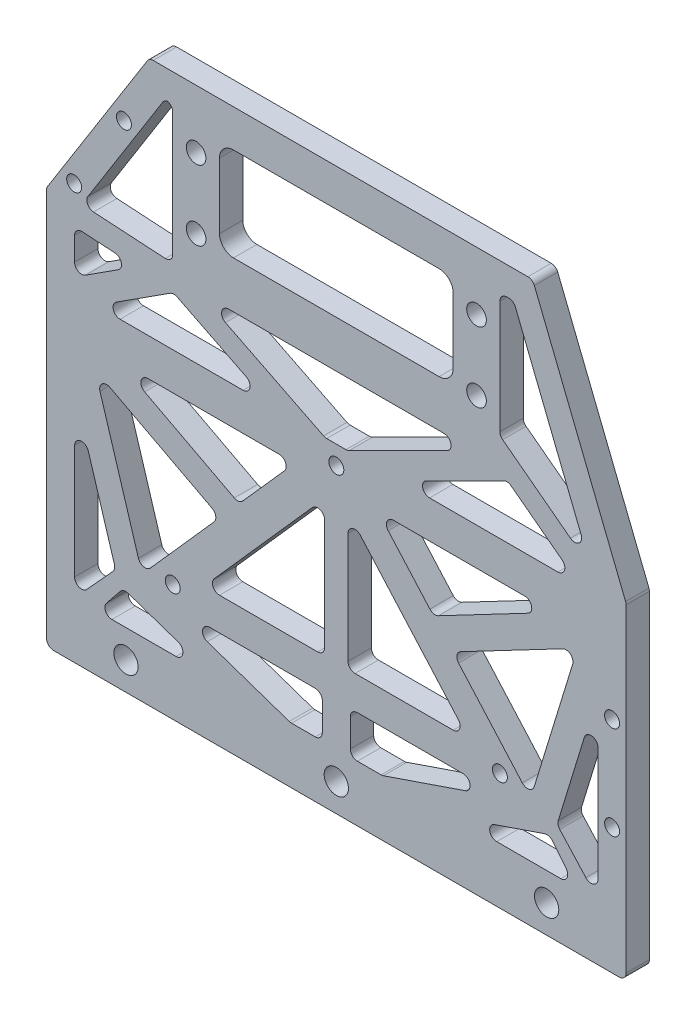
from build123d import *

# Parameters (mm, degrees)
SKETCH_1_W          = 124
SKETCH_1_H          = 120
EXTRUDE_1_DEPTH     = 5
SKETCH_2_R          = 1.6
CUT_EXTRUDE_1_DEPTH = 87.423376467
SKETCH_3_R          = 1.6
CUT_EXTRUDE_2_DEPTH = 87.423376467
SKETCH_4_R          = 2.1
CUT_EXTRUDE_3_DEPTH = 87.423376467
CHAMFER_1_SIZE      = 22
CHAMFER_1_SIZE2     = 35
CHAMFER_2_SIZE      = 50
CHAMFER_2_SIZE2     = 20
SKETCH_7_R          = 2.6
CUT_EXTRUDE_4_DEPTH = 87.423376467
SKETCH_8_R          = 1.6
CUT_EXTRUDE_5_DEPTH = 87.423376467
SKETCH_9_W          = 50
SKETCH_9_H          = 20
CUT_EXTRUDE_6_DEPTH = 10
FILLET_2_R          = 1.5
FILLET_3_R          = 3


with BuildPart() as part:
    # 草图1 → 凸台-拉伸1 (new body)
    with BuildSketch(Plane.XY):
        Rectangle(SKETCH_1_W, SKETCH_1_H)
    extrude(amount=EXTRUDE_1_DEPTH)

    # 草图2 → 切除-拉伸1 (cut, through all)
    with BuildSketch(Plane.XY.offset(5)):
        with Locations((-35, -35)):
            Circle(SKETCH_2_R)
        with Locations((35, -35)):
            Circle(SKETCH_2_R)
    extrude(amount=-CUT_EXTRUDE_1_DEPTH, mode=Mode.SUBTRACT)

    # 草图3 → 切除-拉伸2 (cut, through all)
    with BuildSketch(Plane.XY.offset(5)):
        with Locations((0, 4.5)):
            Circle(SKETCH_3_R)
    extrude(amount=-CUT_EXTRUDE_2_DEPTH, mode=Mode.SUBTRACT)

    # 草图4 → 切除-拉伸3 (cut, through all)
    with BuildSketch(Plane.XY.offset(5)):
        with Locations((-30, 47.5)):
            Circle(SKETCH_4_R)
        with Locations((30, 32.5)):
            Circle(SKETCH_4_R)
        with Locations((30, 47.5)):
            Circle(SKETCH_4_R)
        with Locations((-30, 32.5)):
            Circle(SKETCH_4_R)
    extrude(amount=-CUT_EXTRUDE_3_DEPTH, mode=Mode.SUBTRACT)

    # 倒角1
    chamfer_1_edges = [part.edges().sort_by_distance(p)[0] for p in [
        (-62, 60, 2.5),
    ]]
    chamfer_1_side = [part.faces().sort_by_distance(p)[0] for p in [
        (0, 60, 2.5),
    ]]
    chamfer(chamfer_1_edges, length=CHAMFER_1_SIZE, length2=CHAMFER_1_SIZE2, reference=chamfer_1_side[0])

    # 倒角2
    chamfer_2_edges = [part.edges().sort_by_distance(p)[0] for p in [
        (62, 60, 2.5),
    ]]
    chamfer_2_side = [part.faces().sort_by_distance(p)[0] for p in [
        (62, 0, 2.5),
    ]]
    chamfer(chamfer_2_edges, length=CHAMFER_2_SIZE, length2=CHAMFER_2_SIZE2, reference=chamfer_2_side[0])

    # 草图7 → 切除-拉伸4 (cut, through all)
    with BuildSketch(Plane.XY.offset(5)):
        with Locations((-45, -54)):
            Circle(SKETCH_7_R)
        with Locations((0, -54)):
            Circle(SKETCH_7_R)
        with Locations((45, -54)):
            Circle(SKETCH_7_R)
    extrude(amount=-CUT_EXTRUDE_4_DEPTH, mode=Mode.SUBTRACT)

    # 草图8 → 切除-拉伸5 (cut, through all)
    with BuildSketch(Plane(origin=(0, 0, 0), x_dir=(-1, 0, 0), z_dir=(0, 0, -1))):
        with Locations((-59, -33)):
            Circle(SKETCH_8_R)
        with Locations((-59, -13)):
            Circle(SKETCH_8_R)
        with Locations((45.442663531, 45.703937126)):
            Circle(SKETCH_8_R)
        with Locations((56.086094435, 28.771206142)):
            Circle(SKETCH_8_R)
    extrude(amount=-CUT_EXTRUDE_5_DEPTH, mode=Mode.SUBTRACT)

    # 草图9 → 切除-拉伸6 (cut)
    with BuildSketch(Plane.XY.offset(5)):
        Polygon((-20.795143669, -12.937322966), (-8.888654966, 0.5), (-46.405227211, 0.5), align=None)
        Polygon((46.405227211, 0.5), (8.888654966, 0.5), (20.795143669, -12.937322966), align=None)
        Polygon((36.651188431, 20.030509243), (13.590169944, 8.5), (51.861647432, 8.5), align=None)
        Polygon((-51.376856395, 8.5), (-13.590169944, 8.5), (-34.845181073, 19.127505564), align=None)
        Polygon((-2.409830056, 8.5), (2.409830056, 8.5), (29.409830056, 22), (-29.409830056, 22), align=None)
        with Locations((0, 42)):
            Rectangle(SKETCH_9_W, SKETCH_9_H)
        Polygon((56, -48), (56, -9.733809511), (47.224115046, -38.355523672), align=None)
        Polygon((-56, 20.766320607), (-56, 11.472020889), (-42.786156177, 19.966634775), align=None)
        Polygon((-47.224115046, -38.355523672), (-56, -9.733809511), (-56, -48), align=None)
        Polygon((-54.483388829, 25.683685076), (-35, 24.504573971), (-35, 54), (-36.684562306, 54), align=None)
        Polygon((-41.557478496, -36.369100842), (-24.893558667, -17.562677034), (-51.624213171, -3.53740308), align=None)
        Polygon((51.624213171, -3.53740308), (24.893558667, -17.562677034), (41.557478496, -36.369100842), align=None)
        Polygon((51.155461986, -48), (45.560495731, -41.070588478), (25.28565897, -48), align=None)
        Polygon((35, 27.556493075), (54.396821993, 12.852450597), (37.937802231, 54), (35, 54), align=None)
        Polygon((-25.28565897, -48), (-45.560495731, -41.070588478), (-51.155461986, -48), align=None)
        Polygon((9.825265002, -48), (36.158457982, -39), (3, -39), (3, -48), align=None)
        Polygon((-3, -39), (-36.158457982, -39), (-9.825265002, -48), (-3, -48), align=None)
        Polygon((2.5, -32), (28.333508776, -32), (2.5, -2.845040096), align=None)
        Polygon((-2.5, -32), (-2.5, -2.845040096), (-28.333508776, -32), align=None)
    extrude(amount=-CUT_EXTRUDE_6_DEPTH, mode=Mode.SUBTRACT)

    # 圆角2
    # the kernel refuses this fillet: 1.5 mm, written as the material it adds along each edge
    with BuildSketch(Plane(origin=(-20.795143669, -12.937322966, 5), x_dir=(-0.8855113060794975, 0.46461782876400964, 0), z_dir=(0, 0, -1))) as fillet_2_piece_1:
        with BuildLine():
            CenterArc((FILLET_2_R * 0.783284708727, FILLET_2_R), FILLET_2_R, 193.857889439, 76.142110561)
            Line((-FILLET_2_R * 0.187608070565, FILLET_2_R * 0.760485467833), (0, 0))
            Line((0, 0), (FILLET_2_R * 0.783284708727, 0))
        make_face()
    extrude(amount=5)
    with BuildSketch(Plane(origin=(-46.405227211, 0.5, 5), x_dir=(0.8855113060794989, -0.4646178287640068, 0), z_dir=(0, 0, -1))) as fillet_2_piece_2:
        with BuildLine():
            CenterArc((FILLET_2_R * 4.05819835002, -FILLET_2_R), FILLET_2_R, 90, 152.314508611)
            Line((FILLET_2_R * 3.59358052125, -FILLET_2_R * 1.88551130608), (0, 0))
            Line((0, 0), (FILLET_2_R * 4.05819835002, 0))
        make_face()
    extrude(amount=5)
    with BuildSketch(Plane(origin=(-8.888654966, 0.5, 5), x_dir=(-1, 0, 0), z_dir=(0, 0, -1)), Plane(origin=(-28.333508776, -32, 5), x_dir=(1, 0, 0), z_dir=(0, 0, -1)), Plane(origin=(28.333508776, -32, 5), x_dir=(-0.6631869212816371, 0.7484538111607045, 0), z_dir=(0, 0, -1)), Plane(origin=(8.888654966, 0.5, 5), x_dir=(0.663186921281637, -0.7484538111607046, 0), z_dir=(0, 0, -1))) as fillet_2_piece_3:
        with BuildLine():
            CenterArc((FILLET_2_R * 2.22216374141, -FILLET_2_R), FILLET_2_R, 90, 131.543380828)
            Line((FILLET_2_R * 1.47370993025, -FILLET_2_R * 1.66318692128), (0, 0))
            Line((0, 0), (FILLET_2_R * 2.22216374141, 0))
        make_face()
    extrude(amount=5)
    with BuildSketch(Plane(origin=(-47.224115046, -38.355523672, 5), x_dir=(-0.2931459684588604, 0.9560676969630952, 0), z_dir=(0, 0, -1)), Plane(origin=(47.224115046, -38.355523672, 5), x_dir=(0.673016151793855, -0.7396277843784607, 0), z_dir=(0, 0, -1))) as fillet_2_piece_4:
        with BuildLine():
            CenterArc((FILLET_2_R * 0.569773364902, -FILLET_2_R), FILLET_2_R, 90, 59.346676613)
            Line((-FILLET_2_R * 0.290494540513, -FILLET_2_R * 0.490157739185), (0, 0))
            Line((0, 0), (FILLET_2_R * 0.569773364902, 0))
        make_face()
    extrude(amount=5)
    with BuildSketch(Plane(origin=(-56, -48, 5), x_dir=(0.6730161517938523, 0.7396277843784631, 0), z_dir=(0, 0, -1)), Plane(origin=(56, -48, 5), x_dir=(0, 1, 0), z_dir=(0, 0, -1))) as fillet_2_piece_5:
        with BuildLine():
            CenterArc((FILLET_2_R * 2.58482323157, -FILLET_2_R), FILLET_2_R, 90, 137.699718158)
            Line((FILLET_2_R * 1.91180707978, -FILLET_2_R * 1.73962778438), (0, 0))
            Line((0, 0), (FILLET_2_R * 2.58482323157, 0))
        make_face()
    extrude(amount=5)
    with BuildSketch(Plane(origin=(-56, -9.733809511, 5), x_dir=(0.2931459684588615, -0.956067696963095, 0), z_dir=(0, 0, -1)), Plane(origin=(56, -9.733809511, 5), x_dir=(0, -1, 0), z_dir=(0, 0, -1))) as fillet_2_piece_6:
        with BuildLine():
            CenterArc((FILLET_2_R * 6.6726747335, FILLET_2_R), FILLET_2_R, 107.046394772, 162.953605228)
            Line((FILLET_2_R * 6.37952876504, FILLET_2_R * 1.95606769696), (0, 0))
            Line((0, 0), (FILLET_2_R * 6.6726747335, 0))
        make_face()
    extrude(amount=5)
    with BuildSketch(Plane(origin=(-2.5, -2.845040096, 5), x_dir=(-0.663186921281637, -0.7484538111607046, 0), z_dir=(0, 0, -1)), Plane(origin=(2.5, -2.845040096, 5), x_dir=(0, -1, 0), z_dir=(0, 0, -1))) as fillet_2_piece_7:
        with BuildLine():
            CenterArc((FILLET_2_R * 2.63644193673, -FILLET_2_R), FILLET_2_R, 90, 138.456619172)
            Line((FILLET_2_R * 1.97325501545, -FILLET_2_R * 1.74845381116), (0, 0))
            Line((0, 0), (FILLET_2_R * 2.63644193673, 0))
        make_face()
    extrude(amount=5)
    with BuildSketch(Plane(origin=(-2.5, -32, 5), x_dir=(-1, 0, 0), z_dir=(0, 0, -1)), Plane(origin=(2.5, -32, 5), x_dir=(0, 1, 0), z_dir=(0, 0, -1)), Plane(origin=(-3, -48, 5), x_dir=(-1, 0, 0), z_dir=(0, 0, -1))) as fillet_2_piece_8:
        with BuildLine():
            CenterArc((FILLET_2_R, FILLET_2_R), FILLET_2_R, 180, 90)
            Line((0, FILLET_2_R), (0, 0))
            Line((0, 0), (FILLET_2_R, 0))
        make_face()
    extrude(amount=5)
    with BuildSketch(Plane(origin=(3, -48, 5), x_dir=(1, 0, 0), z_dir=(0, 0, -1)), Plane(origin=(3, -39, 5), x_dir=(0, -1, 0), z_dir=(0, 0, -1)), Plane(origin=(-3, -39, 5), x_dir=(-1, 0, 0), z_dir=(0, 0, -1)), Plane(origin=(-35, 54, 5), x_dir=(-1, 0, 0), z_dir=(0, 0, -1)), Plane(origin=(35, 54, 5), x_dir=(0, -1, 0), z_dir=(0, 0, -1))) as fillet_2_piece_9:
        with BuildLine():
            CenterArc((FILLET_2_R, -FILLET_2_R), FILLET_2_R, 90, 90)
            Line((0, -FILLET_2_R), (0, 0))
            Line((0, 0), (FILLET_2_R, 0))
        make_face()
    extrude(amount=5)
    with BuildSketch(Plane(origin=(36.158457982, -39, 5), x_dir=(-0.946259952100711, -0.3234070238111103, 0), z_dir=(0, 0, -1))) as fillet_2_piece_10:
        with BuildLine():
            CenterArc((FILLET_2_R * 6.01798912456, FILLET_2_R), FILLET_2_R, 108.86909291, 161.13090709)
            Line((FILLET_2_R * 5.69458210075, FILLET_2_R * 1.9462599521), (0, 0))
            Line((0, 0), (FILLET_2_R * 6.01798912456, 0))
        make_face()
    extrude(amount=5)
    with BuildSketch(Plane(origin=(9.825265002, -48, 5), x_dir=(0.9462599521007252, 0.3234070238110687, 0), z_dir=(0, 0, -1)), Plane(origin=(-9.825265002, -48, 5), x_dir=(1, 0, 0), z_dir=(0, 0, -1))) as fillet_2_piece_11:
        with BuildLine():
            CenterArc((FILLET_2_R * 0.166168462472, -FILLET_2_R), FILLET_2_R, 90, 18.86909291)
            Line((-FILLET_2_R * 0.157238561339, -FILLET_2_R * 0.0537400478993), (0, 0))
            Line((0, 0), (FILLET_2_R * 0.166168462472, 0))
        make_face()
    extrude(amount=5)
    with BuildSketch(Plane(origin=(25.28565897, -48, 5), x_dir=(1, 0, 0), z_dir=(0, 0, -1)), Plane(origin=(-36.158457982, -39, 5), x_dir=(0.946259952100711, -0.3234070238111103, 0), z_dir=(0, 0, -1)), Plane(origin=(-25.28565897, -48, 5), x_dir=(-0.9462599521007113, 0.32340702381110964, 0), z_dir=(0, 0, -1))) as fillet_2_piece_12:
        with BuildLine():
            CenterArc((FILLET_2_R * 6.01798912456, -FILLET_2_R), FILLET_2_R, 90, 161.13090709)
            Line((FILLET_2_R * 5.69458210075, -FILLET_2_R * 1.9462599521), (0, 0))
            Line((0, 0), (FILLET_2_R * 6.01798912456, 0))
        make_face()
    extrude(amount=5)
    with BuildSketch(Plane(origin=(45.560495731, -41.070588478, 5), x_dir=(0.6282102919478427, -0.7780435907394947, 0), z_dir=(0, 0, -1)), Plane(origin=(-45.560495731, -41.070588478, 5), x_dir=(0.9462599521007107, -0.3234070238111115, 0), z_dir=(0, 0, -1))) as fillet_2_piece_13:
        with BuildLine():
            CenterArc((FILLET_2_R * 0.699569025654, FILLET_2_R), FILLET_2_R, 200.049111296, 69.950888704)
            Line((-FILLET_2_R * 0.239830086098, FILLET_2_R * 0.657174521309), (0, 0))
            Line((0, 0), (FILLET_2_R * 0.699569025654, 0))
        make_face()
    extrude(amount=5)
    with BuildSketch(Plane(origin=(51.155461986, -48, 5), x_dir=(-0.6282102919478418, 0.7780435907394954, 0), z_dir=(0, 0, -1)), Plane(origin=(-51.155461986, -48, 5), x_dir=(1, 0, 0), z_dir=(0, 0, -1))) as fillet_2_piece_14:
        with BuildLine():
            CenterArc((FILLET_2_R * 2.09269803302, -FILLET_2_R), FILLET_2_R, 90, 128.918204205)
            Line((FILLET_2_R * 1.31465444228, -FILLET_2_R * 1.62821029195), (0, 0))
            Line((0, 0), (FILLET_2_R * 2.09269803302, 0))
        make_face()
    extrude(amount=5)
    with BuildSketch(Plane(origin=(46.405227211, 0.5, 5), x_dir=(-0.8855113060794988, -0.46461782876400726, 0), z_dir=(0, 0, -1))) as fillet_2_piece_15:
        with BuildLine():
            CenterArc((FILLET_2_R * 4.05819835002, FILLET_2_R), FILLET_2_R, 117.685491389, 152.314508611)
            Line((FILLET_2_R * 3.59358052125, FILLET_2_R * 1.88551130608), (0, 0))
            Line((0, 0), (FILLET_2_R * 4.05819835002, 0))
        make_face()
    extrude(amount=5)
    with BuildSketch(Plane(origin=(20.795143669, -12.937322966, 5), x_dir=(0.8855113060794993, 0.46461782876400604, 0), z_dir=(0, 0, -1))) as fillet_2_piece_16:
        with BuildLine():
            CenterArc((FILLET_2_R * 0.783284708727, -FILLET_2_R), FILLET_2_R, 90, 76.142110561)
            Line((-FILLET_2_R * 0.187608070565, -FILLET_2_R * 0.760485467833), (0, 0))
            Line((0, 0), (FILLET_2_R * 0.783284708727, 0))
        make_face()
    extrude(amount=5)
    with BuildSketch(Plane(origin=(-35, 24.504573971, 5), x_dir=(0, 1, 0), z_dir=(0, 0, -1)), Plane(origin=(-56, 20.766320607, 5), x_dir=(0, -1, 0), z_dir=(0, 0, -1))) as fillet_2_piece_17:
        with BuildLine():
            CenterArc((FILLET_2_R * 1.06234837763, -FILLET_2_R), FILLET_2_R, 90, 93.463247259)
            Line((FILLET_2_R * 0.064174624583, -FILLET_2_R * 1.06040826713), (0, 0))
            Line((0, 0), (FILLET_2_R * 1.06234837763, 0))
        make_face()
    extrude(amount=5)
    with BuildSketch(Plane(origin=(-54.483388829, 25.683685076, 5), x_dir=(0.5321715452183424, 0.846636549211007, 0), z_dir=(0, 0, -1))) as fillet_2_piece_18:
        with BuildLine():
            CenterArc((FILLET_2_R * 1.68717716114, FILLET_2_R), FILLET_2_R, 151.310952118, 118.689047882)
            Line((FILLET_2_R * 0.809939218483, FILLET_2_R * 1.48005582172), (0, 0))
            Line((0, 0), (FILLET_2_R * 1.68717716114, 0))
        make_face()
    extrude(amount=5)
    with BuildSketch(Plane(origin=(-36.684562306, 54, 5), x_dir=(-0.5321715452183408, -0.8466365492110081, 0), z_dir=(0, 0, -1))) as fillet_2_piece_19:
        with BuildLine():
            CenterArc((FILLET_2_R * 0.552572949063, -FILLET_2_R), FILLET_2_R, 90, 57.847704859)
            Line((-FILLET_2_R * 0.294063600148, -FILLET_2_R * 0.467828454782), (0, 0))
            Line((0, 0), (FILLET_2_R * 0.552572949063, 0))
        make_face()
    extrude(amount=5)
    with BuildSketch(Plane(origin=(-42.786156177, 19.966634775, 5), x_dir=(-0.9981737530420696, 0.060408267132153484, 0), z_dir=(0, 0, -1))) as fillet_2_piece_20:
        with BuildLine():
            CenterArc((FILLET_2_R * 3.05964186518, -FILLET_2_R), FILLET_2_R, 90, 143.801526468)
            Line((FILLET_2_R * 2.46905769673, -FILLET_2_R * 1.80697604672), (0, 0))
            Line((0, 0), (FILLET_2_R * 3.05964186518, 0))
        make_face()
    extrude(amount=5)
    with BuildSketch(Plane(origin=(-56, 11.472020889, 5), x_dir=(0, 1, 0), z_dir=(0, 0, -1))) as fillet_2_piece_21:
        with BuildLine():
            CenterArc((FILLET_2_R * 1.83166549836, FILLET_2_R), FILLET_2_R, 147.264773728, 122.735226272)
            Line((FILLET_2_R * 0.990487022987, FILLET_2_R * 1.54075759131), (0, 0))
            Line((0, 0), (FILLET_2_R * 1.83166549836, 0))
        make_face()
    extrude(amount=5)
    with BuildSketch(Plane(origin=(-29.409830056, 22, 5), x_dir=(0.8944271909999193, -0.447213595499951, 0), z_dir=(0, 0, -1)), Plane(origin=(29.409830056, 22, 5), x_dir=(-1, 0, 0), z_dir=(0, 0, -1))) as fillet_2_piece_22:
        with BuildLine():
            CenterArc((FILLET_2_R * 4.2360679775, -FILLET_2_R), FILLET_2_R, 90, 153.434948823)
            Line((FILLET_2_R * 3.788854382, -FILLET_2_R * 1.894427191), (0, 0))
            Line((0, 0), (FILLET_2_R * 4.2360679775, 0))
        make_face()
    extrude(amount=5)
    with BuildSketch(Plane(origin=(2.409830056, 8.5, 5), x_dir=(0.8944271909999179, 0.4472135954999539, 0), z_dir=(0, 0, -1))) as fillet_2_piece_23:
        with BuildLine():
            CenterArc((FILLET_2_R * 0.2360679775, -FILLET_2_R), FILLET_2_R, 90, 26.565051177)
            Line((-FILLET_2_R * 0.211145618, -FILLET_2_R * 0.105572809), (0, 0))
            Line((0, 0), (FILLET_2_R * 0.2360679775, 0))
        make_face()
    extrude(amount=5)
    with BuildSketch(Plane(origin=(-2.409830056, 8.5, 5), x_dir=(-0.8944271909999199, 0.4472135954999499, 0), z_dir=(0, 0, -1))) as fillet_2_piece_24:
        with BuildLine():
            CenterArc((FILLET_2_R * 0.2360679775, FILLET_2_R), FILLET_2_R, 243.434948823, 26.565051177)
            Line((-FILLET_2_R * 0.211145618, FILLET_2_R * 0.105572809), (0, 0))
            Line((0, 0), (FILLET_2_R * 0.2360679775, 0))
        make_face()
    extrude(amount=5)
    with BuildSketch(Plane(origin=(13.590169944, 8.5, 5), x_dir=(0.8944271909999199, 0.44721359549995016, 0), z_dir=(0, 0, -1)), Plane(origin=(-13.590169944, 8.5, 5), x_dir=(-1, 0, 0), z_dir=(0, 0, -1))) as fillet_2_piece_25:
        with BuildLine():
            CenterArc((FILLET_2_R * 4.2360679775, FILLET_2_R), FILLET_2_R, 116.565051177, 153.434948823)
            Line((FILLET_2_R * 3.788854382, FILLET_2_R * 1.894427191), (0, 0))
            Line((0, 0), (FILLET_2_R * 4.2360679775, 0))
        make_face()
    extrude(amount=5)
    with BuildSketch(Plane(origin=(36.651188431, 20.030509243, 5), x_dir=(-0.8944271909999189, -0.4472135954999518, 0), z_dir=(0, 0, -1))) as fillet_2_piece_26:
        with BuildLine():
            CenterArc((FILLET_2_R * 0.62159223034, -FILLET_2_R), FILLET_2_R, 90, 63.729526071)
            Line((-FILLET_2_R * 0.27512240761, -FILLET_2_R * 0.557390851781), (0, 0))
            Line((0, 0), (FILLET_2_R * 0.62159223034, 0))
        make_face()
    extrude(amount=5)
    with BuildSketch(Plane(origin=(51.861647432, 8.5, 5), x_dir=(-0.7969046345270256, 0.6041051261737046, 0), z_dir=(0, 0, -1))) as fillet_2_piece_27:
        with BuildLine():
            CenterArc((FILLET_2_R * 2.97448996321, -FILLET_2_R), FILLET_2_R, 90, 142.835525106)
            Line((FILLET_2_R * 2.37038483704, -FILLET_2_R * 1.79690463453), (0, 0))
            Line((0, 0), (FILLET_2_R * 2.97448996321, 0))
        make_face()
    extrude(amount=5)
    with BuildSketch(Plane(origin=(-34.845181073, 19.127505564, 5), x_dir=(-0.8411784753765612, -0.540757591313487, 0), z_dir=(0, 0, -1))) as fillet_2_piece_28:
        with BuildLine():
            CenterArc((FILLET_2_R * 0.569237129121, -FILLET_2_R), FILLET_2_R, 90, 59.300277449)
            Line((-FILLET_2_R * 0.29061761472, -FILLET_2_R * 0.489461245845), (0, 0))
            Line((0, 0), (FILLET_2_R * 0.569237129121, 0))
        make_face()
    extrude(amount=5)
    with BuildSketch(Plane(origin=(-51.376856395, 8.5, 5), x_dir=(1, 0, 0), z_dir=(0, 0, -1))) as fillet_2_piece_29:
        with BuildLine():
            CenterArc((FILLET_2_R * 3.40481299745, -FILLET_2_R), FILLET_2_R, 90, 147.264773728)
            Line((FILLET_2_R * 2.86405540614, -FILLET_2_R * 1.84117847538), (0, 0))
            Line((0, 0), (FILLET_2_R * 3.40481299745, 0))
        make_face()
    extrude(amount=5)
    with BuildSketch(Plane(origin=(-51.624213171, -3.53740308, 5), x_dir=(0.29314596845886026, -0.9560676969630952, 0), z_dir=(0, 0, -1)), Plane(origin=(51.624213171, -3.53740308, 5), x_dir=(-0.8855113060794988, -0.464617828764007, 0), z_dir=(0, 0, -1))) as fillet_2_piece_30:
        with BuildLine():
            CenterArc((FILLET_2_R * 2.39832656555, -FILLET_2_R), FILLET_2_R, 90, 134.731886161)
            Line((FILLET_2_R * 1.68791865389, -FILLET_2_R * 1.70379016692), (0, 0))
            Line((0, 0), (FILLET_2_R * 2.39832656555, 0))
        make_face()
    extrude(amount=5)
    with BuildSketch(Plane(origin=(-24.893558667, -17.562677034, 5), x_dir=(-0.6631869212816379, -0.748453811160704, 0), z_dir=(0, 0, -1)), Plane(origin=(24.893558667, -17.562677034, 5), x_dir=(0.8855113060794996, 0.46461782876400576, 0), z_dir=(0, 0, -1))) as fillet_2_piece_31:
        with BuildLine():
            CenterArc((FILLET_2_R * 1.27667499296, FILLET_2_R), FILLET_2_R, 166.142110561, 103.857889439)
            Line((FILLET_2_R * 0.305782213669, FILLET_2_R * 1.23951453217), (0, 0))
            Line((0, 0), (FILLET_2_R * 1.27667499296, 0))
        make_face()
    extrude(amount=5)
    with BuildSketch(Plane(origin=(-41.557478496, -36.369100842, 5), x_dir=(0.6631869212816383, 0.7484538111607038, 0), z_dir=(0, 0, -1)), Plane(origin=(41.557478496, -36.369100842, 5), x_dir=(0.29314596845886154, 0.9560676969630948, 0), z_dir=(0, 0, -1))) as fillet_2_piece_32:
        with BuildLine():
            CenterArc((FILLET_2_R * 1.78235165433, -FILLET_2_R), FILLET_2_R, 90, 121.4102244)
            Line((FILLET_2_R * 0.92889384453, -FILLET_2_R * 1.52116193921), (0, 0))
            Line((0, 0), (FILLET_2_R * 1.78235165433, 0))
        make_face()
    extrude(amount=5)
    with BuildSketch(Plane(origin=(35, 27.556493075, 5), x_dir=(0.7969046345270255, -0.6041051261737048, 0), z_dir=(0, 0, -1))) as fillet_2_piece_33:
        with BuildLine():
            CenterArc((FILLET_2_R * 0.496790778562, -FILLET_2_R), FILLET_2_R, 90, 52.835525106)
            Line((-FILLET_2_R * 0.300113855965, -FILLET_2_R * 0.395894873826), (0, 0))
            Line((0, 0), (FILLET_2_R * 0.496790778562, 0))
        make_face()
    extrude(amount=5)
    with BuildSketch(Plane(origin=(37.937802231, 54, 5), x_dir=(0.3713906763541013, -0.9284766908852602, 0), z_dir=(0, 0, -1))) as fillet_2_piece_34:
        with BuildLine():
            CenterArc((FILLET_2_R * 0.677032961427, FILLET_2_R), FILLET_2_R, 201.801409486, 68.198590514)
            Line((-FILLET_2_R * 0.251443729458, FILLET_2_R * 0.628609323646), (0, 0))
            Line((0, 0), (FILLET_2_R * 0.677032961427, 0))
        make_face()
    extrude(amount=5)
    with BuildSketch(Plane(origin=(54.396821993, 12.852450597, 5), x_dir=(-0.3713906763541008, 0.9284766908852605, 0), z_dir=(0, 0, -1))) as fillet_2_piece_35:
        with BuildLine():
            CenterArc((FILLET_2_R * 3.6017192565, -FILLET_2_R), FILLET_2_R, 90, 148.96588438)
            Line((FILLET_2_R * 3.08617088988, -FILLET_2_R * 1.8568604797), (0, 0))
            Line((0, 0), (FILLET_2_R * 3.6017192565, 0))
        make_face()
    extrude(amount=5)
    # the kernel refuses this fillet: 1.5 mm, written as the material it takes off along each edge
    with BuildSketch(Plane(origin=(-62, 25, -1.080690889), x_dir=(0.532171545218355, 0.8466365492109991, 0), z_dir=(0, 0, 1))) as fillet_2_2_piece_1:
        with BuildLine():
            CenterArc((FILLET_2_R * 0.288184237145, -FILLET_2_R), FILLET_2_R, 90, 32.152295141)
            Line((-FILLET_2_R * 0.243987308073, -FILLET_2_R * 0.153363450789), (0, 0))
            Line((0, 0), (FILLET_2_R * 0.288184237145, 0))
        make_face()
    extrude(amount=7.161381779, mode=Mode.SUBTRACT)
    with BuildSketch(Plane(origin=(-40, 60, -2.072148559), x_dir=(1, 0, 0), z_dir=(0, 0, 1))) as fillet_2_2_piece_2:
        with BuildLine():
            CenterArc((FILLET_2_R * 0.552572949063, -FILLET_2_R), FILLET_2_R, 90, 57.847704859)
            Line((-FILLET_2_R * 0.294063600148, -FILLET_2_R * 0.467828454782), (0, 0))
            Line((0, 0), (FILLET_2_R * 0.552572949063, 0))
        make_face()
    extrude(amount=9.144297118, mode=Mode.SUBTRACT)
    with BuildSketch(Plane(origin=(42, 60, -2.538873605), x_dir=(-1, 0, 0), z_dir=(0, 0, 1))) as fillet_2_2_piece_3:
        with BuildLine():
            CenterArc((FILLET_2_R * 0.677032961427, FILLET_2_R), FILLET_2_R, 201.801409486, 68.198590514)
            Line((-FILLET_2_R * 0.251443729458, FILLET_2_R * 0.628609323646), (0, 0))
            Line((0, 0), (FILLET_2_R * 0.677032961427, 0))
        make_face()
    extrude(amount=10.077747211, mode=Mode.SUBTRACT)
    with BuildSketch(Plane(origin=(62, 10, -0.722184013), x_dir=(-0.3713906763541143, 0.9284766908852551, 0), z_dir=(0, 0, 1))) as fillet_2_2_piece_4:
        with BuildLine():
            CenterArc((FILLET_2_R * 0.192582403567, FILLET_2_R), FILLET_2_R, 248.198590514, 21.801409486)
            Line((-FILLET_2_R * 0.178808272787, FILLET_2_R * 0.0715233091147), (0, 0))
            Line((0, 0), (FILLET_2_R * 0.192582403567, 0))
        make_face()
    extrude(amount=6.444368027, mode=Mode.SUBTRACT)
    with BuildSketch(Plane(origin=(62, -60, -3.75), x_dir=(0, 1, 0), z_dir=(0, 0, 1))) as fillet_2_2_piece_5:
        with BuildLine():
            CenterArc((FILLET_2_R, FILLET_2_R), FILLET_2_R, 180, 90)
            Line((0, FILLET_2_R), (0, 0))
            Line((0, 0), (FILLET_2_R, 0))
        make_face()
    extrude(amount=12.5, mode=Mode.SUBTRACT)
    with BuildSketch(Plane(origin=(-62, -60, -3.75), x_dir=(0, 1, 0), z_dir=(0, 0, 1))) as fillet_2_2_piece_6:
        with BuildLine():
            CenterArc((FILLET_2_R, -FILLET_2_R), FILLET_2_R, 90, 90)
            Line((0, -FILLET_2_R), (0, 0))
            Line((0, 0), (FILLET_2_R, 0))
        make_face()
    extrude(amount=12.5, mode=Mode.SUBTRACT)

    # 圆角3
    fillet_3_edges = [part.edges().sort_by_distance(p)[0] for p in [
        (-25, 52, 2.5),
        (25, 52, 2.5),
        (25, 32, 2.5),
        (-25, 32, 2.5),
    ]]
    fillet(fillet_3_edges, radius=FILLET_3_R)


solid = part.part
